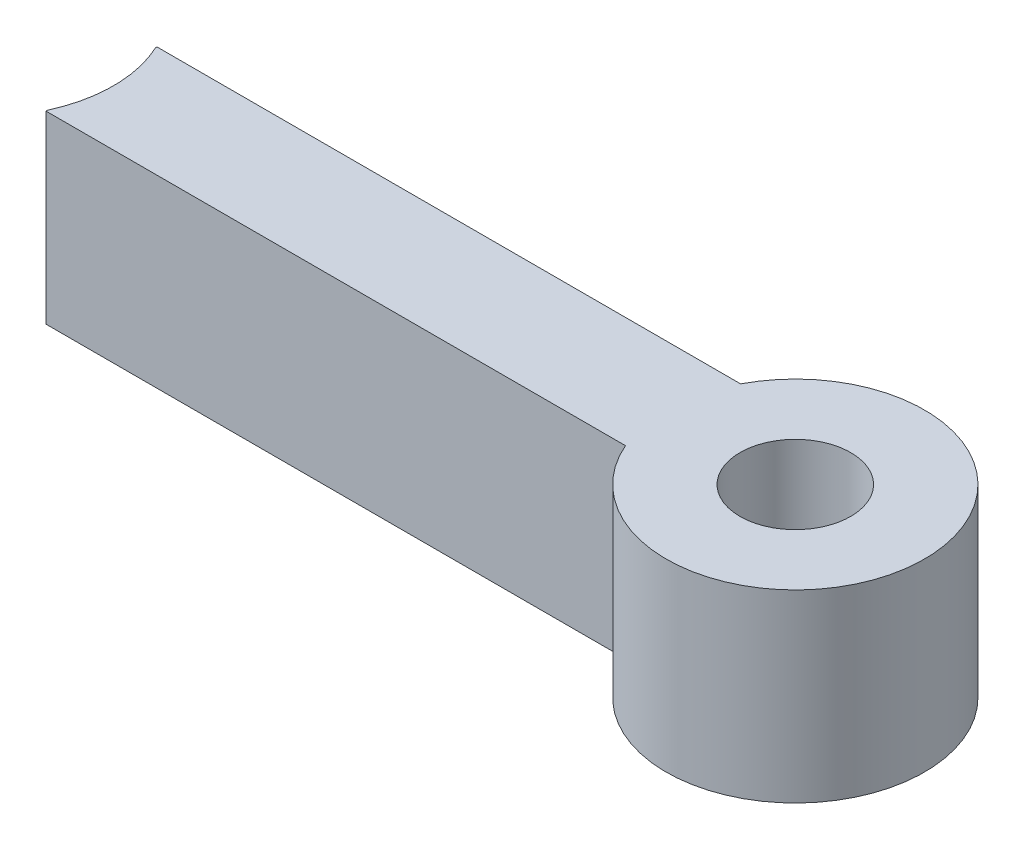
from build123d import *

# Parameters (mm, degrees)
BOSS_EXTRU_2_DEPTH      = 100
ESQUISSE5_R             = 30
ENL_V_MAT_EXTRU_4_DEPTH = 527.130239045
ESQUISSE6_R             = 69.62268605
ENL_V_MAT_EXTRU_5_DEPTH = 527.130239045


with BuildPart() as part:
    # Esquisse1 → Boss.-Extru.2 (new body)
    with BuildSketch(Plane(origin=(0, 0, 0), x_dir=(1, 0, 0), z_dir=(0, 1, 0))):
        with BuildLine():
            Line((379.401849177, 30.095541494), (63.200145428, 30.095541494))
            Line((63.200145428, 30.095541494), (63.200145428, -30.095541494))
            Line((63.200145428, -30.095541494), (377.209706533, -30.095541494))
            ThreePointArc((377.209706533, -30.095541494), (511.408174051, -4.847552565), (379.401849177, 30.095541494))
        make_face()
    extrude(amount=BOSS_EXTRU_2_DEPTH)

    # Esquisse5 → Enlèv. mat.-Extru.4 (cut, through all)
    with BuildSketch(Plane(origin=(0, 100, 0), x_dir=(1, 0, 0), z_dir=(0, 1, 0))):
        with Locations((441.45455179, -2.299860933)):
            Circle(ESQUISSE5_R)
    extrude(amount=-ENL_V_MAT_EXTRU_4_DEPTH, mode=Mode.SUBTRACT)

    # Esquisse6 → Enlèv. mat.-Extru.5 (cut, through all)
    with BuildSketch(Plane(origin=(0, 100, 0), x_dir=(1, 0, 0), z_dir=(0, 1, 0))):
        Circle(ESQUISSE6_R)
    extrude(amount=-ENL_V_MAT_EXTRU_5_DEPTH, mode=Mode.SUBTRACT)


solid = part.part
